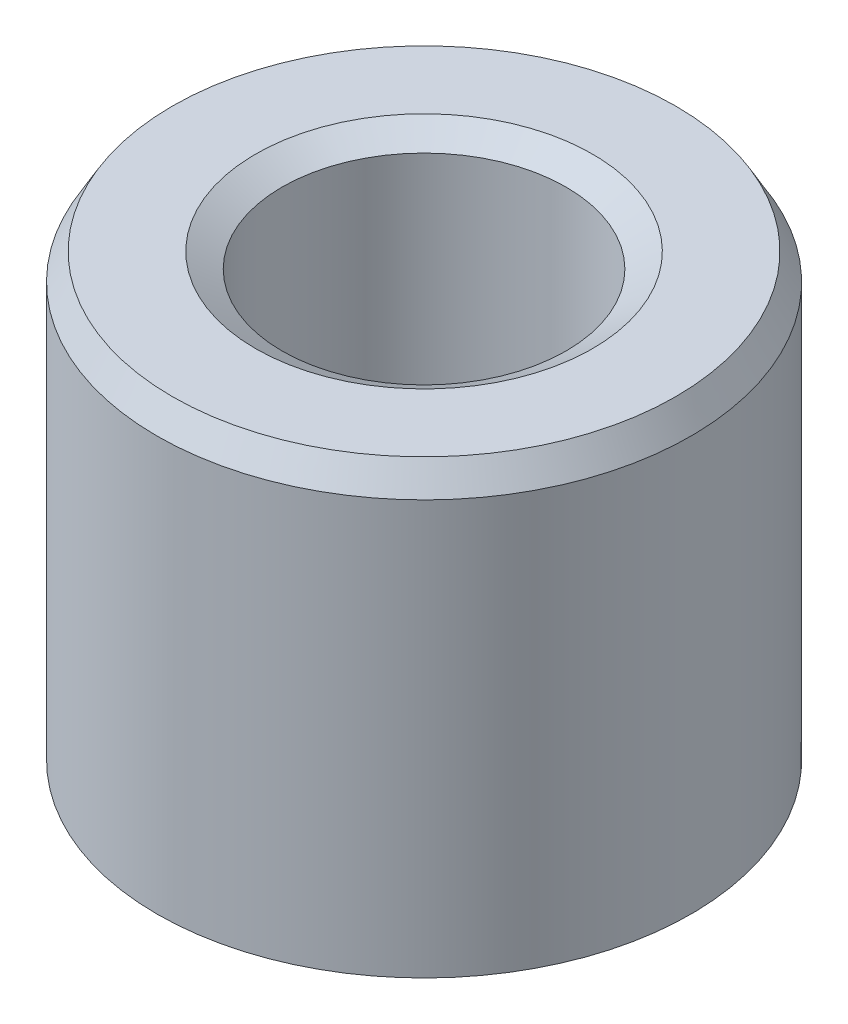
from build123d import *
from OCP.BRepFilletAPI import BRepFilletAPI_MakeChamfer

# Parameters (mm, degrees)
SKETCH1_R           = 5
BOSS_EXTRUDE1_DEPTH = 8.536632556
SKETCH2_R           = 2.659828081
CUT_EXTRUDE1_DEPTH  = 12.084858835
CHAMFER1_SIZE       = 0.496035197
CHAMFER1_SIZE2      = 0.286386054


with BuildPart() as part:
    # Sketch1 → Boss-Extrude1 (new body)
    with BuildSketch(Plane(origin=(0, 0, 0), x_dir=(1, 0, 0), z_dir=(0, 1, 0))):
        Circle(SKETCH1_R)
    extrude(amount=BOSS_EXTRUDE1_DEPTH)

    # Sketch2 → Cut-Extrude1 (cut, through all)
    with BuildSketch(Plane(origin=(0, 0, 0), x_dir=(1, 0, 0), z_dir=(0, 1, 0))):
        Circle(SKETCH2_R)
    extrude(amount=CUT_EXTRUDE1_DEPTH, mode=Mode.SUBTRACT)

    # Chamfer1: one chamfer whose edges measure the first distance from different faces: ONE call of the kernel's chamfer builder (chamfer() names one face for all edges)
    chamfer1_edges_1 = [part.edges().sort_by_distance(p)[0] for p in [
        (-2.659828081, 8.536632556, 0),
    ]]
    chamfer1_side_1 = [part.faces().sort_by_distance(p)[0] for p in [
        (-4.858578644, 8.536632556, 0),
    ]]
    chamfer1_edges_2 = [part.edges().sort_by_distance(p)[0] for p in [
        (-2.659828081, 0, 0),
    ]]
    chamfer1_side_2 = [part.faces().sort_by_distance(p)[0] for p in [
        (-2.659828081, 4.268316278, 0),
    ]]
    chamfer1_edges_3 = [part.edges().sort_by_distance(p)[0] for p in [
        (-5, 0, 0),
    ]]
    chamfer1_side_3 = [part.faces().sort_by_distance(p)[0] for p in [
        (-4.858578644, 0, 0),
    ]]
    chamfer1_edges_4 = [part.edges().sort_by_distance(p)[0] for p in [
        (-5, 8.536632556, 0),
    ]]
    chamfer1_side_4 = [part.faces().sort_by_distance(p)[0] for p in [
        (-5, 4.268316278, 0),
    ]]
    chamfer1 = BRepFilletAPI_MakeChamfer(part.part.solid().wrapped)
    for e in chamfer1_edges_1:
        chamfer1.Add(CHAMFER1_SIZE, CHAMFER1_SIZE2, e.wrapped, chamfer1_side_1[0].wrapped)  # the first distance lies on this face
    for e in chamfer1_edges_2:
        chamfer1.Add(CHAMFER1_SIZE, CHAMFER1_SIZE2, e.wrapped, chamfer1_side_2[0].wrapped)  # the first distance lies on this face
    for e in chamfer1_edges_3:
        chamfer1.Add(CHAMFER1_SIZE, CHAMFER1_SIZE2, e.wrapped, chamfer1_side_3[0].wrapped)  # the first distance lies on this face
    for e in chamfer1_edges_4:
        chamfer1.Add(CHAMFER1_SIZE, CHAMFER1_SIZE2, e.wrapped, chamfer1_side_4[0].wrapped)  # the first distance lies on this face
    add(Compound.cast(chamfer1.Shape()), mode=Mode.REPLACE)


solid = part.part
